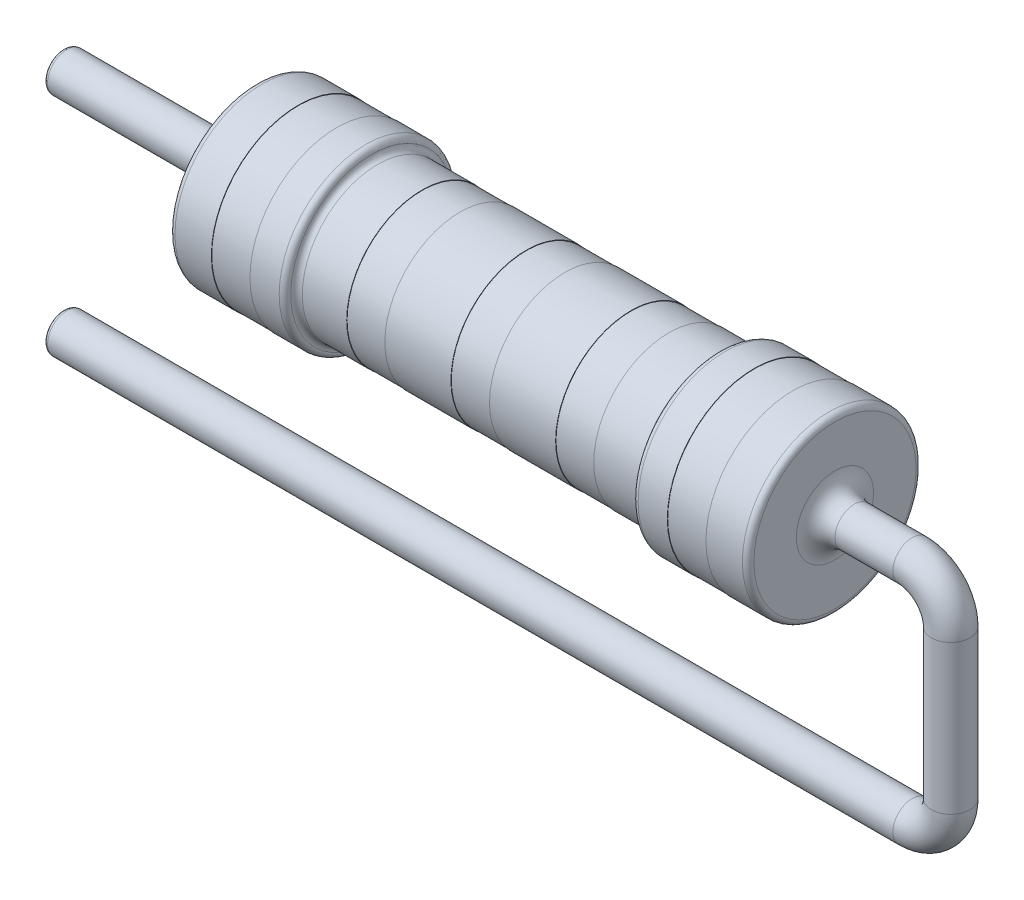
from build123d import *

# Parameters (mm, degrees)
FILLET2_R = 0.15
FILLET3_R = 0.15
SKETCH3_R = 0.5
SKETCH5_R = 0.5
FILLET4_R = 0.1
FILLET5_R = 0.5


with BuildPart() as part:
    # Sketch1 → Revolve2 (revolve)
    with BuildSketch(Plane.XY, mode=Mode.PRIVATE) as revolve2_sk:
        Polygon((-7.5, -1.897389039), (7.5, -1.897389039), (7.5, -4.147389039), (6.406849222, -4.147389039), (6.406849222, -4.137389039), (5.406849222, -4.137389039), (5.406849222, -4.147389039), (4.5, -4.147389039), (4.5, -3.847389039), (3.2, -3.847389039), (3.2, -3.837389039), (2.212680485, -3.837389039), (2.212680485, -3.847389039), (0.5, -3.847389039), (0.5, -3.837389039), (-0.5, -3.837389039), (-0.5, -3.847389039), (-2.212680485, -3.847389039), (-2.212680485, -3.837389039), (-3.2, -3.837389039), (-3.2, -3.847389039), (-4.5, -3.847389039), (-4.5, -4.147389039), (-5.406849222, -4.147389039), (-5.406849222, -4.137389039), (-6.406849222, -4.137389039), (-6.406849222, -4.147389039), (-7.5, -4.147389039), align=None)
    revolve(revolve2_sk.sketch.rotate(Axis((-7.5, -1.897389039, 0), (1, 0, 0)), 270), axis=Axis((-7.5, -1.897389039, 0), (1, 0, 0)))

    # Fillet2
    fillet2_edges = [part.edges().sort_by_distance(p)[0] for p in [
        (-7.5, -1.897389039, -2.25),
        (7.5, -1.897389039, -2.25),
        (4.5, -1.897389039, -2.25),
        (-4.5, -1.897389039, -2.25),
    ]]
    fillet(fillet2_edges, radius=FILLET2_R)

    # Fillet3
    fillet3_edges = [part.edges().sort_by_distance(p)[0] for p in [
        (4.5, -1.897389039, -1.95),
        (-4.5, -1.897389039, -1.95),
    ]]
    fillet(fillet3_edges, radius=FILLET3_R - 0.0001)  # a hair under: the kernel refuses the full size

    # Sweep2: sweep along a curve in space
    with BuildLine() as sweep2_path:
        Line((7.5, -1.897389039, 0), (9.5, -1.897389039, 0))
        ThreePointArc((10.5, -2.897389039, 0), (10.207106781, -2.190282258, 0), (9.5, -1.897389039, 0))
        Line((10.5, -2.897389039, 0), (10.5, -6.753958043, 0))
        ThreePointArc((9.5, -7.753958043, 0), (10.207106781, -7.461064824, 0), (10.5, -6.753958043, 0))
        Line((9.5, -7.753958043, 0), (-12.5, -7.753958043, 0))
    # Sketch3 → Sweep2 (sweep)
    with BuildSketch(Plane(origin=(7.5, 0, 0), x_dir=(0, 0, -1), z_dir=(1, 0, 0))):
        with Locations((0, -1.897389039)):
            Circle(SKETCH3_R)
    sweep(path=sweep2_path.line)

    # Sweep3: sweep along a curve in space
    with BuildLine() as sweep3_path:
        Line((-7.5, -1.897389039, 0), (-12.5, -1.897389039, 0))
    # Sketch5 → Sweep3 (sweep)
    with BuildSketch(Plane.ZY.offset(7.5)):
        with Locations((0, -1.897389039)):
            Circle(SKETCH5_R)
    sweep(path=sweep3_path.line)

    # Fillet4
    fillet4_edges = [part.edges().sort_by_distance(p)[0] for p in [
        (-12.5, -7.753958043, 0.5),
        (-12.5, -1.897389039, -0.5),
    ]]
    fillet(fillet4_edges, radius=FILLET4_R)

    # Fillet5
    fillet5_edges = [part.edges().sort_by_distance(p)[0] for p in [
        (7.5, -1.897389039, 0.5),
        (-7.5, -1.897389039, -0.5),
    ]]
    fillet(fillet5_edges, radius=FILLET5_R)


solid = part.part
